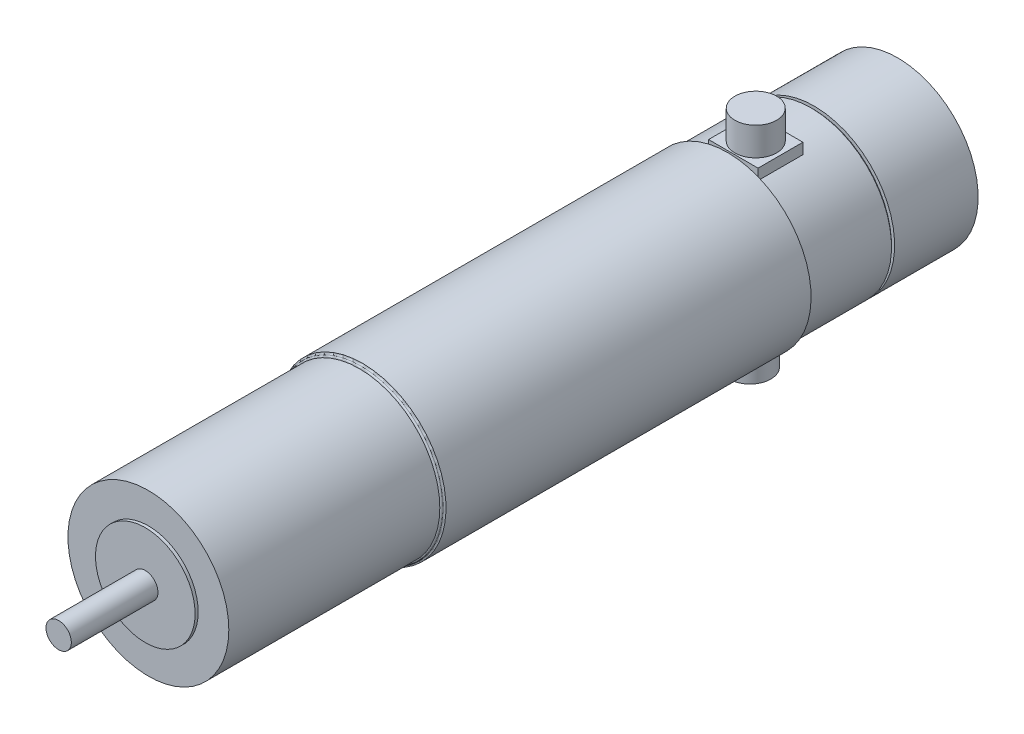
from build123d import *

# Parameters (mm, degrees)
SKETCH1_R                 = 26
BOSS_EXTRUDE3_DEPTH       = 34.1
SKETCH4_R                 = 16.098
BOSS_EXTRUDE4_DEPTH       = 1
SKETCH5_R                 = 4.098
BOSS_EXTRUDE5_DEPTH       = 28
SKETCH7_R                 = 26.5
BOSS_EXTRUDE6_DEPTH       = 1
SKETCH8_R                 = 27
BOSS_EXTRUDE8_DEPTH       = 118
SKETCH12_R                = 26
BOSS_EXTRUDE9_DEPTH       = 27
SKETCH13_R                = 25.5
BOSS_EXTRUDE10_DEPTH      = 0.5
SKETCH16_R                = 13.192
BOSS_EXTRUDE12_DEPTH      = 2
SKETCH19_R                = 2.408
BOSS_EXTRUDE13_DEPTH      = 1
BOSS_EXTRUDE14_REACH      = 195.426
BOSS_EXTRUDE14_END_RADIUS = 26
SKETCH20_W                = 16
SKETCH20_H                = 14.5
FILLET2_R                 = 0.5
MIRROR2_START             = -208.1
MIRROR2_OUTLINE_R         = 26
MIRROR2_DEPTH             = 27
BOSS_EXTRUDE17_REACH      = 218.958
BOSS_EXTRUDE17_END_RADIUS = 26
SKETCH24_W                = 16
SKETCH24_H                = 14.5
SKETCH25_R                = 6.75
BOSS_EXTRUDE18_DEPTH      = 9.144
SKETCH26_R                = 6.75
BOSS_EXTRUDE19_DEPTH      = 9.144


# Read off the part's stored shape, not the designer's step: Mirror2
with BuildPart() as part:
    # Sketch1 → Boss-Extrude3 (new, symmetric)
    with BuildSketch(Plane.XY):
        Circle(SKETCH1_R)
    extrude(amount=BOSS_EXTRUDE3_DEPTH, both=True)

    # Sketch4 → Boss-Extrude4 (add)
    with BuildSketch(Plane.XY.offset(34.1)):
        Circle(SKETCH4_R)
    extrude(amount=BOSS_EXTRUDE4_DEPTH)

    # Sketch5 → Boss-Extrude5 (add)
    with BuildSketch(Plane.XY.offset(35.1)):
        Circle(SKETCH5_R)
    extrude(amount=BOSS_EXTRUDE5_DEPTH)

    # Sketch7 → Boss-Extrude6 (add)
    with BuildSketch(Plane(origin=(0, 0, -34.1), x_dir=(-1, 0, 0), z_dir=(0, 0, -1))):
        Circle(SKETCH7_R)
    extrude(amount=BOSS_EXTRUDE6_DEPTH)

    # Sketch8 → Boss-Extrude8 (add)
    with BuildSketch(Plane(origin=(0, 0, -35.1), x_dir=(-1, 0, 0), z_dir=(0, 0, -1))):
        Circle(SKETCH8_R)
    extrude(amount=BOSS_EXTRUDE8_DEPTH)

    # Sketch12 → Boss-Extrude9 (add)
    with BuildSketch(Plane(origin=(0, 0, -153.1), x_dir=(-1, 0, 0), z_dir=(0, 0, -1))):
        with Locations(Location((0, 0, 0), (0, 0, 180))):
            Circle(SKETCH12_R)
    extrude(amount=BOSS_EXTRUDE9_DEPTH)

    # Sketch13 → Boss-Extrude10 (add)
    with BuildSketch(Plane(origin=(0, 0, -180.1), x_dir=(-1, 0, 0), z_dir=(0, 0, -1))):
        Circle(SKETCH13_R)
    extrude(amount=BOSS_EXTRUDE10_DEPTH)

    # Sketch16 → Boss-Extrude12 (add)
    with BuildSketch(Plane(origin=(0, 0, -180.6), x_dir=(-1, 0, 0), z_dir=(0, 0, -1))):
        Circle(SKETCH16_R)
    extrude(amount=BOSS_EXTRUDE12_DEPTH)

    # Sketch19 → Boss-Extrude13 (add)
    with BuildSketch(Plane(origin=(0, 0, -182.6), x_dir=(-1, 0, 0), z_dir=(0, 0, -1))):
        Circle(SKETCH19_R)
    extrude(amount=BOSS_EXTRUDE13_DEPTH)

    # Boss-Extrude14: up to this cylinder (the profile starts outside it)
    boss_extrude14_end = Plane(origin=(0, 0, -160.35), z_dir=(0, 0, 1)) * Cylinder(BOSS_EXTRUDE14_END_RADIUS, 443.852, mode=Mode.PRIVATE)
    # Sketch20 → Boss-Extrude14 (add, up to the surface)
    with BuildSketch(Plane(origin=(0, 27.551, 0), x_dir=(1, 0, 0), z_dir=(0, 1, 0)), mode=Mode.PRIVATE) as boss_extrude14_sk1:
        with Locations((1.860761864, 160.35)):
            Rectangle(SKETCH20_W, SKETCH20_H)
    boss_extrude14_tool1 = extrude(boss_extrude14_sk1.sketch, amount=-BOSS_EXTRUDE14_REACH, mode=Mode.PRIVATE) - boss_extrude14_end
    add(boss_extrude14_tool1.solids().sort_by_distance((1.860762, 27.551, -160.35))[0])

    # Fillet2
    fillet2_edges = [part.edges().sort_by_distance(p)[0] for p in [
        (26.5, 0, -34.1),
        (26.5, 0, -35.1),
    ]]
    fillet(fillet2_edges, radius=FILLET2_R - 0.0001)  # a hair under: the kernel refuses the full size

    # Mirror2 outline → Mirror2 (add)
    with BuildSketch(Plane.XY.offset(MIRROR2_START)):
        Circle(MIRROR2_OUTLINE_R)
    extrude(amount=MIRROR2_DEPTH)

    # Boss-Extrude17: up to this cylinder (the profile starts outside it)
    boss_extrude17_end = Plane(origin=(0, 0, -160.35), z_dir=(0, 0, 1)) * Cylinder(BOSS_EXTRUDE17_END_RADIUS, 490.916, mode=Mode.PRIVATE)
    # Sketch24 → Boss-Extrude17 (add, up to the surface)
    with BuildSketch(Plane(origin=(0, -27.551, 0), x_dir=(1, 0, 0), z_dir=(0, 1, 0)), mode=Mode.PRIVATE) as boss_extrude17_sk1:
        with Locations((0, 160.35)):
            Rectangle(SKETCH24_W, SKETCH24_H)
    boss_extrude17_tool1 = extrude(boss_extrude17_sk1.sketch, amount=BOSS_EXTRUDE17_REACH, mode=Mode.PRIVATE) - boss_extrude17_end
    add(boss_extrude17_tool1.solids().sort_by_distance((0, -27.551, -160.35))[0])

    # Sketch25 → Boss-Extrude18 (add)
    with BuildSketch(Plane(origin=(0, -27.551, 0), x_dir=(-1, 0, 0), z_dir=(0, -1, 0))):
        with Locations(Location((0, 160.35, 0), (0, 0, 90))):
            Circle(SKETCH25_R)
    extrude(amount=BOSS_EXTRUDE18_DEPTH)

    # Sketch26 → Boss-Extrude19 (add)
    with BuildSketch(Plane(origin=(0, 27.551, 0), x_dir=(1, 0, 0), z_dir=(0, 1, 0))):
        with Locations(Location((1.860761864, 160.35, 0), (0, 0, 270))):
            Circle(SKETCH26_R)
    extrude(amount=BOSS_EXTRUDE19_DEPTH)


solid = part.part
